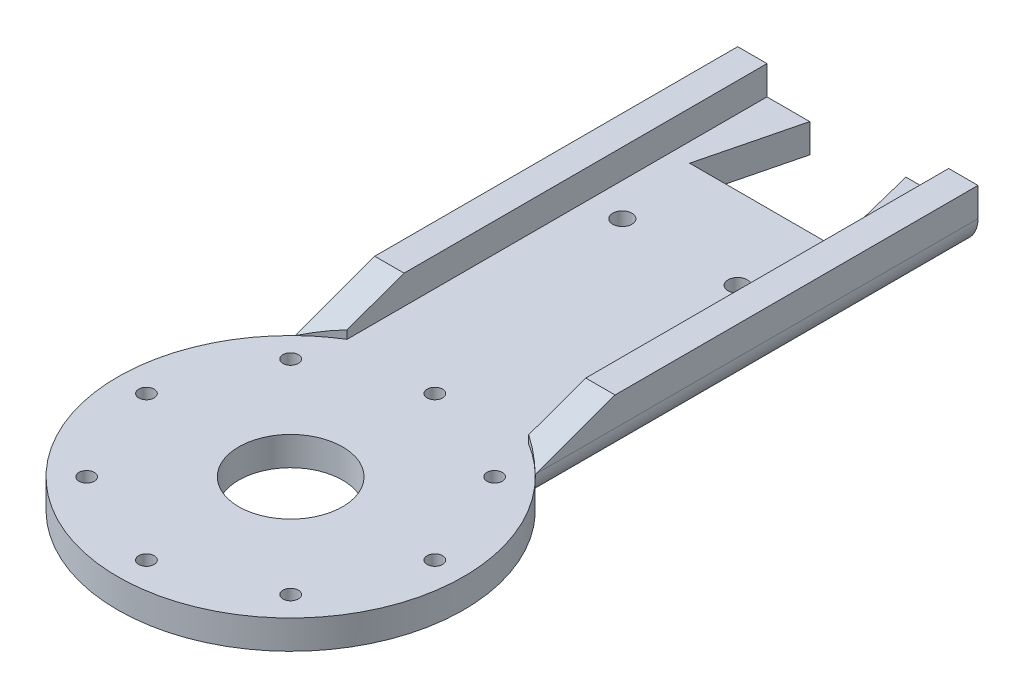
from build123d import *

# Parameters (mm, degrees)
CROQUIS1_R              = 5.400000088
CROQUIS1_R_2            = 0.999999877
CROQUIS1_R_3            = 1.000000024
CROQUIS1_R_4            = 0.800000203
SALIENTE_EXTRUIR1_DEPTH = 3
SALIENTE_EXTRUIR2_DEPTH = 3
CORTAR_EXTRUIR1_DEPTH   = 42
REDONDEO1_R             = 3


with BuildPart() as part:
    # Croquis1 → Saliente-Extruir1 (new body)
    with BuildSketch(Plane(origin=(0, 0, 0), x_dir=(1, 0, 0), z_dir=(0, 1, 0))):
        with BuildLine():
            Line((-12.273088561, 38.840382277), (-4.773088561, 38.840382277))
            Line((-4.773088561, 38.840382277), (-7.273088561, 28.840382277))
            Line((-7.273088561, 28.840382277), (7.726911439, 28.840382277))
            Line((7.726911439, 28.840382277), (5.226911439, 38.840382277))
            Line((5.226911439, 38.840382277), (12.726911439, 38.840382277))
            Line((12.726911439, 38.840382277), (12.726911439, -7.216334642))
            ThreePointArc((12.726911439, -7.216334642), (0.226911439, -38.159647961), (-12.273088561, -7.216334642))
            Line((-12.273088561, -7.216334642), (-12.273088561, 38.840382277))
        make_face()
        with Locations(Location((0.226911124, -20.159617436, 0), (0, 0, 270))):
            Circle(CROQUIS1_R, mode=Mode.SUBTRACT)
        with Locations(Location((6.226911439, 20.340382277, 0), (0, 0, 270))):
            Circle(CROQUIS1_R_2, mode=Mode.SUBTRACT)
        with Locations(Location((-5.77308837, 20.34038236, 0), (0, 0, 270))):
            Circle(CROQUIS1_R_3, mode=Mode.SUBTRACT)
        with Locations(Location((0.226911439, -5.159617656, 0), (0, 0, 270))):
            Circle(CROQUIS1_R_4, mode=Mode.SUBTRACT)
        with Locations(Location((10.836055587, -9.554069047, 0), (0, 0, 270))):
            Circle(CROQUIS1_R_4, mode=Mode.SUBTRACT)
        with Locations(Location((15.230506978, -20.163213195, 0), (0, 0, 270))):
            Circle(CROQUIS1_R_4, mode=Mode.SUBTRACT)
        with Locations(Location((10.836055587, -30.772357343, 0), (0, 0, 270))):
            Circle(CROQUIS1_R_4, mode=Mode.SUBTRACT)
        with Locations(Location((0.226911439, -35.166808735, 0), (0, 0, 270))):
            Circle(CROQUIS1_R_4, mode=Mode.SUBTRACT)
        with Locations(Location((-10.382232709, -30.772357343, 0), (0, 0, 270))):
            Circle(CROQUIS1_R_4, mode=Mode.SUBTRACT)
        with Locations(Location((-14.776684101, -20.163213195, 0), (0, 0, 270))):
            Circle(CROQUIS1_R_4, mode=Mode.SUBTRACT)
        with Locations(Location((-10.382232709, -9.554069047, 0), (0, 0, 270))):
            Circle(CROQUIS1_R_4, mode=Mode.SUBTRACT)
    extrude(amount=SALIENTE_EXTRUIR1_DEPTH)

    # Croquis2 → Saliente-Extruir2 (add)
    with BuildSketch(Plane(origin=(0, 3, 0), x_dir=(1, 0, 0), z_dir=(0, 1, 0))):
        with BuildLine():
            Line((-12.273088561, 38.840382277), (-9.223088561, 38.840382277))
            Line((-9.223088561, 38.840382277), (-9.223088561, -4.847006046))
            ThreePointArc((-9.223088561, -4.847006046), (-10.811840961, -5.949602868), (-12.273088561, -7.216334642))
            Line((-12.273088561, -7.216334642), (-12.273088561, 38.840382277))
        make_face()
        with BuildLine():
            Line((9.676910809, 38.840382277), (9.676910809, -4.847006046))
            ThreePointArc((9.676910809, -4.847006046), (11.265663208, -5.949602868), (12.726910809, -7.216334642))
            Line((12.726910809, -7.216334642), (12.726910809, 38.840382277))
            Line((12.726910809, 38.840382277), (9.676910809, 38.840382277))
        make_face()
    extrude(amount=SALIENTE_EXTRUIR2_DEPTH)

    # Croquis3 → Cortar-Extruir1 (cut)
    with BuildSketch(Plane.ZY.offset(12.273088561)):
        Polygon((-1.083665358, 6), (7.216334642, 3), (7.216334642, 6), align=None)
    extrude(amount=-CORTAR_EXTRUIR1_DEPTH, mode=Mode.SUBTRACT)

    # Redondeo1
    redondeo1_edges = [part.edges().sort_by_distance(p)[0] for p in [
        (12.726911439, 0, -15.812023818),
        (-12.273088561, 0, -15.812023818),
    ]]
    fillet(redondeo1_edges, radius=REDONDEO1_R - 0.0001)  # a hair under: the kernel refuses the full size


solid = part.part
